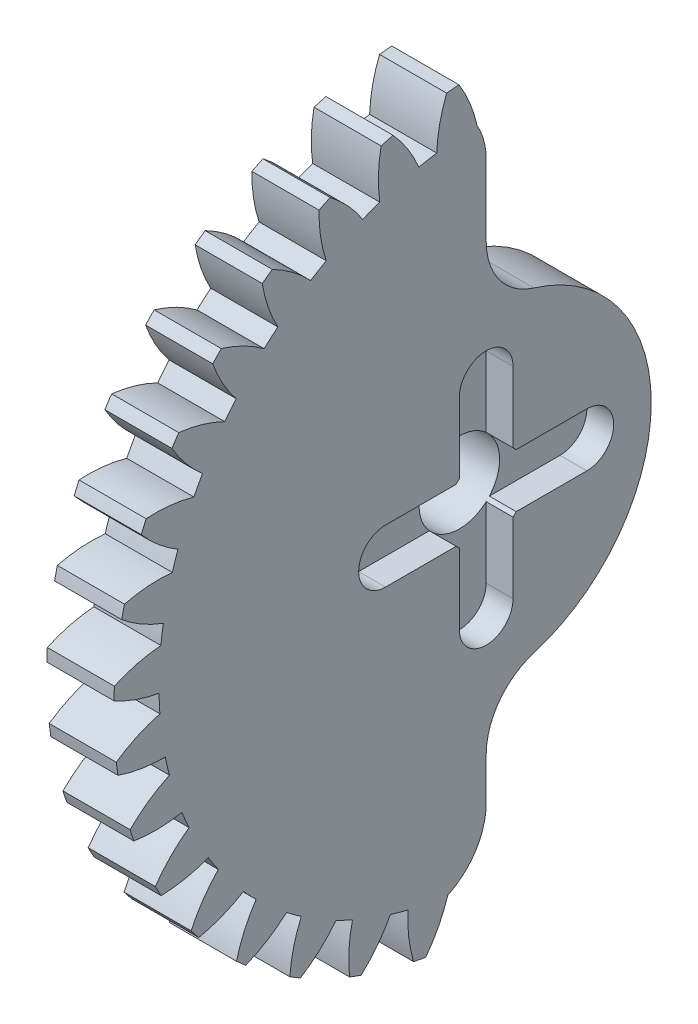
from build123d import *

# Parameters (mm, degrees)
BASPROSKE_W             = 7
BASPROSKE_H             = 27.75
TOOTHCUT_DEPTH          = 40.863830724
TEETHCUTS_COUNT         = 35
TEETHCUTS_ANGLE         = 349.714285714
BORSKE_R                = 3
BORE_DEPTH              = 50.0000508
CUT_EXTRUDE1_DEPTH      = 2
CUT_EXTRUDE2_DEPTH      = 2
CUT_EXTRUDE3_DEPTH      = 10
CUT_EXTRUDE4_DEPTH      = 2
FILLET2_R               = 5
CUT_EXTRUDE5_DEPTH      = 10
FILLET3_R               = 5
CUT_EXTRUDE6_DEPTH      = 40.804405632
CUT_EXTRUDE6_DEPTH_BACK = 40.804405632


with BuildPart() as part:
    # BasProSke → Base-Revolve (revolve)
    with BuildSketch(Plane(origin=(0, 0, 0), x_dir=(1, 0, 0), z_dir=(0, 1, 0)), mode=Mode.PRIVATE) as base_revolve_sk:
        with Locations((3.5, 13.875)):
            Rectangle(BASPROSKE_W, BASPROSKE_H)
    revolve(base_revolve_sk.sketch.rotate(Axis((-10, 0, 0), (1, 0, 0)), 180), axis=Axis((-10, 0, 0), (1, 0, 0)))

    # TooCutSke → ToothCut (cut, through all)
    with BuildSketch(Plane(origin=(0, 0, 0), x_dir=(0, 0, -1), z_dir=(1, 0, 0))):
        with BuildLine():
            ThreePointArc((0.678148312, 24.364564245), (0, 24.374), (-0.678148312, 24.364564245))
            ThreePointArc((-0.678148312, 24.364564245), (-1.217075524, 26.091376176), (-2.044396801, 27.70005933))
            ThreePointArc((-2.044396801, 27.70005933), (0, 27.7754), (2.044396801, 27.70005933))
            ThreePointArc((2.044396801, 27.70005933), (1.217075524, 26.091376176), (0.678148312, 24.364564245))
        make_face()
    toothcut = extrude(amount=TOOTHCUT_DEPTH, mode=Mode.SUBTRACT)

    # TeethCuts: ToothCut ×35 about axis
    teethcuts_axis = Axis((-10, 0, 0), (1, 0, 0))
    for i in range(1, TEETHCUTS_COUNT):
        add(toothcut.rotate(teethcuts_axis, i * TEETHCUTS_ANGLE / (TEETHCUTS_COUNT - 1)), mode=Mode.SUBTRACT)

    # BorSke → Bore (cut, symmetric)
    with BuildSketch(Plane(origin=(0, 0, 0), x_dir=(0, 0, -1), z_dir=(1, 0, 0))):
        with Locations(Location((0, 0, 0), (0, 0, 180))):
            Circle(BORSKE_R)
    extrude(amount=BORE_DEPTH, both=True, mode=Mode.SUBTRACT)

    # Sketch3 → Cut-Extrude1 (cut)
    with BuildSketch(Plane(origin=(7, 0, 0), x_dir=(0, 0, -1), z_dir=(1, 0, 0))):
        with BuildLine():
            Line((-1.5, -7.5), (-1.5, 7.5))
            ThreePointArc((-1.5, 7.5), (0, 9), (1.5, 7.5))
            Line((1.5, 7.5), (1.5, -7.5))
            ThreePointArc((1.5, -7.5), (0, -9), (-1.5, -7.5))
        make_face()
    extrude(amount=-CUT_EXTRUDE1_DEPTH, mode=Mode.SUBTRACT)

    # Sketch4 → Cut-Extrude2 (cut)
    with BuildSketch(Plane(origin=(7, 0, 0), x_dir=(0, 0, -1), z_dir=(1, 0, 0))):
        with BuildLine():
            Line((-7.5, 1.5), (7.5, 1.5))
            ThreePointArc((7.5, 1.5), (9, 0), (7.5, -1.5))
            Line((7.5, -1.5), (-7.5, -1.5))
            ThreePointArc((-7.5, -1.5), (-9, 0), (-7.5, 1.5))
        make_face()
    extrude(amount=-CUT_EXTRUDE2_DEPTH, mode=Mode.SUBTRACT)

    # Sketch5 → Cut-Extrude3 (cut)
    with BuildSketch(Plane(origin=(7, 0, 0), x_dir=(0, 0, -1), z_dir=(1, 0, 0))):
        with BuildLine():
            ThreePointArc((12.297844577, 0), (8.695889295, -8.695889295), (0, -12.297844577))
            Line((0, -12.297844577), (0, -32.483772695))
            ThreePointArc((0, -32.483772695), (32.823056407, 0.339283713), (0, 33.16234012))
            Line((0, 33.16234012), (0, 12.297844577))
            ThreePointArc((0, 12.297844577), (8.695889295, 8.695889295), (12.297844577, 0))
        make_face()
    extrude(amount=-CUT_EXTRUDE3_DEPTH, mode=Mode.SUBTRACT)

    # Sketch6 → Cut-Extrude4 (cut)
    with BuildSketch(Plane(origin=(7, 0, 0), x_dir=(0, 0, -1), z_dir=(1, 0, 0))):
        with BuildLine():
            Line((-2, 2), (-2, 7.5))
            ThreePointArc((-2, 7.5), (0, 9.5), (2, 7.5))
            Line((2, 7.5), (2, 2))
            Line((2, 2), (7.5, 2))
            ThreePointArc((7.5, 2), (9.5, 0), (7.5, -2))
            Line((7.5, -2), (2, -2))
            Line((2, -2), (2, -7.5))
            ThreePointArc((2, -7.5), (0, -9.5), (-2, -7.5))
            Line((-2, -7.5), (-2, -2))
            Line((-2, -2), (-7.5, -2))
            ThreePointArc((-7.5, -2), (-9.5, 0), (-7.5, 2))
            Line((-7.5, 2), (-2, 2))
        make_face()
    extrude(amount=-CUT_EXTRUDE4_DEPTH, mode=Mode.SUBTRACT)

    # Fillet2
    fillet2_edges = [part.edges().sort_by_distance(p)[0] for p in [
        (3.5, -12.297844577, 0),
        (3.5, 12.297844577, 0),
    ]]
    fillet(fillet2_edges, radius=FILLET2_R)

    # Sketch8 → Cut-Extrude5 (cut)
    with BuildSketch(Plane(origin=(7, 0, 0), x_dir=(0, 0, -1), z_dir=(1, 0, 0))):
        Polygon((-2.859440987, -24.205690927), (-1.508604415, -24.327268419), (1.243700079, -24.574980307), (1.243700079, -32.134713867), (-1.933875746, -26.979191879), align=None)
    extrude(amount=-CUT_EXTRUDE5_DEPTH, mode=Mode.SUBTRACT)

    # Fillet3
    # the kernel refuses this fillet: 5 mm, written as the material it takes off along each edge
    with BuildSketch(Plane(origin=(13.309286436, 24.374, 0), x_dir=(0, -1, 0), z_dir=(-1, 0, 0))) as fillet3_piece_1:
        with BuildLine():
            CenterArc((2.523714574, 5), FILLET3_R, 239.81088364, 30.18911636)
            Line((0.009435755, 0.678148312), (-0.040849822, 0.591711278))
            ThreePointArc((-0.040849822, 0.591711278), (-0.097631269, 0.340498242), (-0.1, 0))
            Line((-0.1, 0), (0, -0.1))
            Line((0, -0.1), (2.523714574, -0.1))
            Line((2.523714574, -0.1), (2.523714574, 0))
        make_face()
    extrude(amount=19.618572871, mode=Mode.SUBTRACT)
    with BuildSketch(Plane(origin=(-11.93995811, -24.463045274, 0), x_dir=(0, 0.08963930890343594, 0.995974293995239), z_dir=(1, 0, 0))) as fillet3_piece_2:
        with BuildLine():
            CenterArc((5.407987307, -4.308559995), FILLET3_R, 120.490647096, 64.652210046)
            Line((0.428115837, -4.75675654), (0.328518408, -4.76572047))
            Line((0.328518408, -4.76572047), (-0.099597429, -0.008963931))
            Line((-0.099597429, -0.008963931), (0, 0.1))
            ThreePointArc((0, 0.1), (1.435499392, 0.1), (2.820259013, 0.0861712))
            Line((2.820259013, 0.0861712), (2.870998784, 0))
        make_face()
    extrude(amount=30.87991622, mode=Mode.SUBTRACT)

    # Sketch9 → Cut-Extrude6 (cut, two sides: drawn at the far end of the back side and taken through both)
    with BuildSketch(Plane(origin=(0, 0, 0), x_dir=(1, 0, 0), z_dir=(0, 1, 0)).offset(-CUT_EXTRUDE6_DEPTH_BACK)):
        Polygon((-2.448455727, -28.878486524), (2, -28.878486524), (2, 12.992603003), (-3.949809534, 12.992603003), (-3.949809534, -28.878486524), align=None)
    extrude(amount=CUT_EXTRUDE6_DEPTH + CUT_EXTRUDE6_DEPTH_BACK, mode=Mode.SUBTRACT)


solid = part.part
